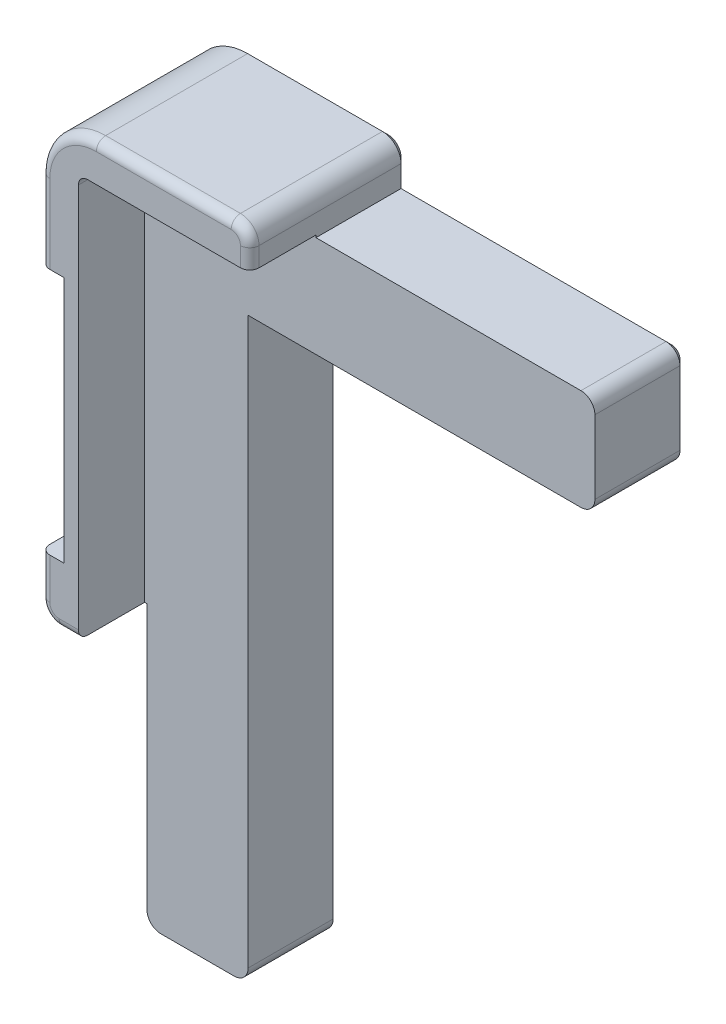
from build123d import *

# Parameters (mm, degrees)
BODY_AND_TONGUES_DEPTH     = 4.875
RIM_DEPTH                  = 8.435
BRACKET_SEAT_SKETCH_W      = 3.5
BRACKET_SEAT_SKETCH_H      = 26.6
BRACKET_SEAT_DEPTH         = 9.435
SCREW_PILOTS_SKETCH_R      = 1.35
SCREW_PILOTS_DEPTH         = 5.5
BUMPER_CORNER_R            = 6
INSIDE_CORNER_OF_THE_RIM_R = 1
RIM_ENDS_R                 = 2
TONGUE_LEAD_IN_R           = 1.5
RIM_TOP_EDGE_R             = 1
BED_FACE_CHAMFER_SIZE      = 0.6


with BuildPart() as part:
    # body and tongues sketch → body and tongues (new, symmetric)
    with BuildSketch(Plane.XY.offset(20.375)):
        Polygon((-4.42, 7.07), (18.08, 7.07), (18.08, 2.75), (48.08, 2.75), (48.08, -8.13), (10.78, -8.13), (10.78, -70.43), (-0.1, -70.43), (-0.1, -40.43), (-4.42, -40.43), align=None)
    extrude(amount=BODY_AND_TONGUES_DEPTH, both=True)

    # rim sketch → rim (add, symmetric)
    with BuildSketch(Plane.XY.offset(23.935)):
        Polygon((-4.42, 7.07), (18.08, 7.07), (18.08, 3), (-0.35, 3), (-0.35, -40.43), (-4.42, -40.43), align=None)
    extrude(amount=RIM_DEPTH, both=True)

    # bracket seat sketch → bracket seat (cut, symmetric)
    with BuildSketch(Plane.XY.offset(23.935)):
        with Locations((-3.67, -20.7)):
            Rectangle(BRACKET_SEAT_SKETCH_W, BRACKET_SEAT_SKETCH_H)
    extrude(amount=BRACKET_SEAT_DEPTH, both=True, mode=Mode.SUBTRACT)

    # screw pilots sketch → screw pilots (cut, symmetric)
    with BuildSketch(Plane(origin=(2.58, 0, 0), x_dir=(0, 0, -1), z_dir=(1, 0, 0))):
        with Locations((-20.375, -28.7)):
            Circle(SCREW_PILOTS_SKETCH_R)
        with Locations((-20.375, -12.7)):
            Circle(SCREW_PILOTS_SKETCH_R)
    extrude(amount=SCREW_PILOTS_DEPTH, both=True, mode=Mode.SUBTRACT)

    # bumper corner
    bumper_corner_edges = [part.edges().sort_by_distance(p)[0] for p in [
        (-4.42, 7.07, 23.935),
    ]]
    fillet(bumper_corner_edges, radius=BUMPER_CORNER_R)

    # inside corner of the rim
    inside_corner_of_the_rim_edges = [part.edges().sort_by_distance(p)[0] for p in [
        (-0.35, 3, 28.81),
    ]]
    fillet(inside_corner_of_the_rim_edges, radius=INSIDE_CORNER_OF_THE_RIM_R)

    # rim ends
    rim_ends_edges = [part.edges().sort_by_distance(p)[0] for p in [
        (18.08, 7.07, 23.935),
        (-4.42, -40.43, 23.935),
    ]]
    fillet(rim_ends_edges, radius=RIM_ENDS_R)

    # tongue lead-in
    tongue_lead_in_edges = [part.edges().sort_by_distance(p)[0] for p in [
        (48.08, -8.13, 20.375),
        (48.08, 2.75, 20.375),
        (10.78, -70.43, 20.375),
        (-0.1, -70.43, 20.375),
    ]]
    fillet(tongue_lead_in_edges, radius=TONGUE_LEAD_IN_R)

    # rim top edge
    rim_top_edge_edges = [part.edges().sort_by_distance(p)[0] for p in [
        (18.08, 4.035, 32.37),
        (17.494213562, 6.484213562, 32.37),
        (-4.42, -3.165, 32.37),
        (-2.662640687, 5.312640687, 32.37),
        (-1.385, -40.43, 32.37),
        (-3.834213562, -39.844213562, 32.37),
        (8.83, 7.07, 32.37),
        (-4.42, -36.215, 32.37),
    ]]
    fillet(rim_top_edge_edges, radius=RIM_TOP_EDGE_R)

    # bed face chamfer
    bed_face_chamfer_edges = [part.edges().sort_by_distance(p)[0] for p in [
        (47.640660172, 2.310660172, 15.5),
        (32.33, 2.75, 15.5),
        (18.08, 3.91, 15.5),
        (17.494213562, 6.484213562, 15.5),
        (8.83, 7.07, 15.5),
        (-2.662640687, 5.312640687, 15.5),
        (-4.42, -3.165, 15.5),
        (-3.17, -7.4, 15.5),
        (-1.92, -20.7, 15.5),
        (-3.17, -34, 15.5),
        (-4.42, -36.215, 15.5),
        (-3.834213562, -39.844213562, 15.5),
        (-1.26, -40.43, 15.5),
        (-0.1, -54.68, 15.5),
        (0.339339828, -69.990660172, 15.5),
        (5.34, -70.43, 15.5),
        (10.340660172, -69.990660172, 15.5),
        (10.78, -38.53, 15.5),
        (28.68, -8.13, 15.5),
        (47.640660172, -7.690660172, 15.5),
        (48.08, -2.69, 15.5),
    ]]
    chamfer(bed_face_chamfer_edges, length=BED_FACE_CHAMFER_SIZE)


solid = part.part
